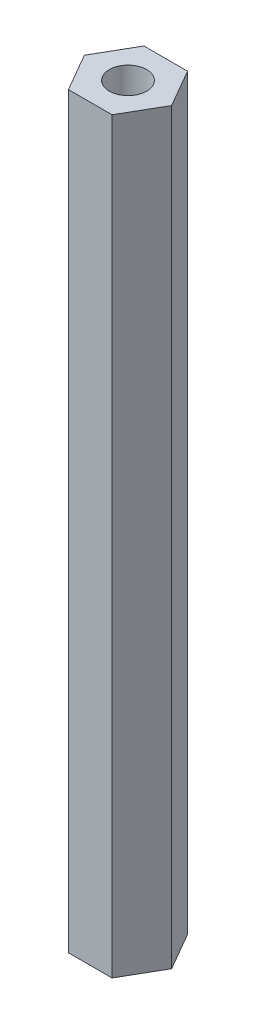
from build123d import *

# Parameters (mm, degrees)
SKETCH1_R           = 1.5
BOSS_EXTRUDE1_DEPTH = 60


with BuildPart() as part:
    # Sketch1 → Boss-Extrude1 (new body)
    with BuildSketch(Plane(origin=(0, 0, 0), x_dir=(1, 0, 0), z_dir=(0, 1, 0))):
        Polygon((-3.498678555, 0), (-1.749339277, -3.029944508), (1.749339277, -3.029944508), (3.498678555, 0), (1.749339277, 3.029944508), (-1.749339277, 3.029944508), align=None)
        Circle(SKETCH1_R, mode=Mode.SUBTRACT)
    extrude(amount=BOSS_EXTRUDE1_DEPTH)


solid = part.part
